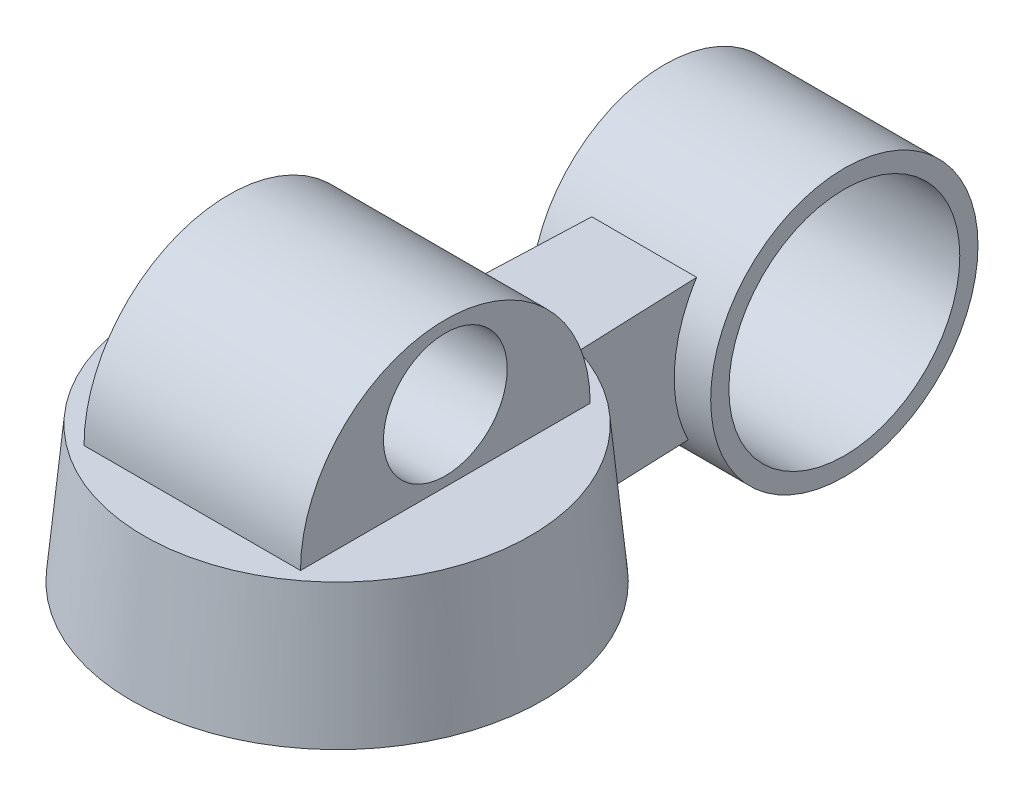
from build123d import *

# Parameters (mm, degrees)
BOSS_EXTRUDE1_DEPTH      = 24.380571
BOSS_EXTRUDE1_DEPTH_BACK = 24.380571
SKETCH2_R                = 13.935202
BOSS_EXTRUDE2_DEPTH      = 30.655768
BOSS_EXTRUDE3_DEPTH      = 20.236561
BOSS_EXTRUDE3_DEPTH_BACK = 20.236561
SKETCH5_R                = 30.106112
SKETCH6_R                = 26.004647
CUT_EXTRUDE1_DEPTH       = 155.427964012


with BuildPart() as part:
    # Sketch1 → Revolve1 (revolve)
    with BuildSketch(Plane.XY):
        Polygon((-40.3145498, 0), (-46.3804, 0), (-43.5102, 30.655768), (0, 30.655768), (0, 11.70178), (-40.3145498, 11.70178), align=None)
    revolve(axis=Axis((0, 0, 0), (0, -1, 0)))

    # Sketch2 → Boss-Extrude1 (add, two sides: drawn at the far end of the back side and taken through both)
    with BuildSketch(Plane(origin=(0, 0, 0), x_dir=(0, 0, -1), z_dir=(1, 0, 0)).offset(-BOSS_EXTRUDE1_DEPTH_BACK)):
        with BuildLine():
            Line((0, 30.655768), (-32.625284, 30.655768))
            ThreePointArc((-32.625284, 30.655768), (0, 63.281052), (32.625284, 30.655768))
            Line((32.625284, 30.655768), (0, 30.655768))
        make_face()
        with Locations((0, 46.734476)):
            Circle(SKETCH2_R, mode=Mode.SUBTRACT)
    extrude(amount=BOSS_EXTRUDE1_DEPTH + BOSS_EXTRUDE1_DEPTH_BACK)

    # Sketch4 → Boss-Extrude2 (add)
    with BuildSketch(Plane(origin=(0, 0, 0), x_dir=(1, 0, 0), z_dir=(0, 1, 0))):
        Polygon((12.72794, 45.609256), (10.780776, 95.954596), (-10.780776, 95.954596), (-12.72794, 45.609256), (-12.927645356, 40.445728926), (12.927645356, 40.445728926), align=None)
    extrude(amount=BOSS_EXTRUDE2_DEPTH)

    # Sketch5 → Boss-Extrude3 (add, two sides: drawn at the far end of the back side and taken through both)
    with BuildSketch(Plane(origin=(0, 0, 0), x_dir=(0, 0, -1), z_dir=(1, 0, 0)).offset(-BOSS_EXTRUDE3_DEPTH_BACK)):
        with Locations((94.013528, 13.638022)):
            Circle(SKETCH5_R)
    extrude(amount=BOSS_EXTRUDE3_DEPTH + BOSS_EXTRUDE3_DEPTH_BACK)

    # Sketch6 → Cut-Extrude1 (cut, through all)
    with BuildSketch(Plane(origin=(20.236561, 0, 0), x_dir=(0, 0, -1), z_dir=(1, 0, 0))):
        with Locations((94.013528, 13.638022)):
            Circle(SKETCH6_R)
    extrude(amount=-CUT_EXTRUDE1_DEPTH, mode=Mode.SUBTRACT)


solid = part.part
